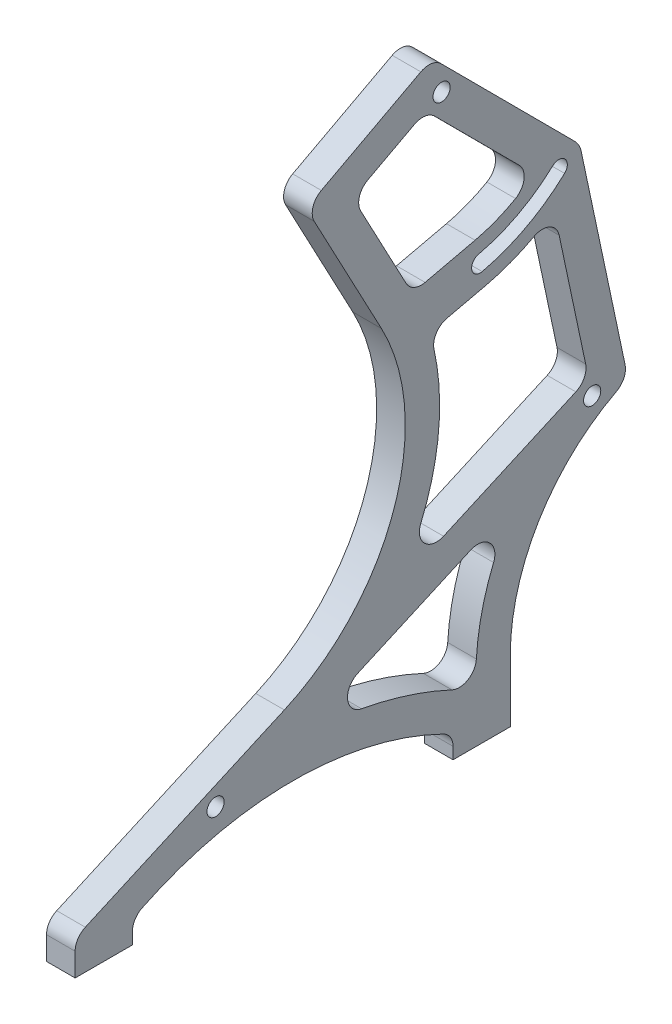
from build123d import *

# Parameters (mm, degrees)
SKETCH1_R                   = 1.5
BOSS_EXTRUDE1_DEPTH         = 5
FILLET1_R                   = 3
TAP_DRILL_FOR_M3_TAP1_D     = 2.5
TAP_DRILL_FOR_M3_TAP1_DEPTH = 7
TAP_DRILL_FOR_M3_TAP1_TIP   = 0.751075774
CUT_EXTRUDE2_REACH          = 146.084
SKETCH7_R                   = 1.5


with BuildPart() as part:
    # Sketch1 → Boss-Extrude1 (new body)
    with BuildSketch(Plane(origin=(0, 0, 0), x_dir=(0, 0, -1), z_dir=(1, 0, 0))):
        with BuildLine():
            Line((0, 0), (0, 6))
            Line((0, 6), (36.541818306, 22.269465723))
            ThreePointArc((36.541818306, 22.269465723), (55.71908903, 43.197784292), (53.491952961, 71.496231166))
            Line((53.491952961, 71.496231166), (40.346749203, 96.218763766))
            Line((40.346749203, 96.218763766), (62.341129166, 107.913383036))
            Line((62.341129166, 107.913383036), (87.292806812, 82.883380245))
            ThreePointArc((87.292806812, 82.883380245), (87.976923892, 81.964881089), (88.3727246, 80.89017244))
            Line((88.3727246, 80.89017244), (95.267840008, 48.415975159))
            Line((95.267840008, 48.415975159), (96.541915319, 42.415412364))
            ThreePointArc((96.541915319, 42.415412364), (81.586078245, 29.641920784), (76, 10.783636674))
            Line((76, 10.783636674), (76, 0))
            Line((76, 0), (66, 0))
            Line((66, 0), (66, 3.884469182))
            ThreePointArc((66, 3.884469182), (38, 10.818472536), (10, 3.884469182))
            Line((10, 3.884469182), (10, 0))
            Line((10, 0), (0, 0))
        make_face()
        with Locations((64, 102)):
            Circle(SKETCH1_R, mode=Mode.SUBTRACT)
        with BuildLine():
            Line((77.130343232, 33.772823644), (39.032120003, 16.810401803))
            ThreePointArc((39.032120003, 16.810401803), (55.025629399, 14.584670036), (70, 8.541951295))
            Line((70, 8.541951295), (70, 10.783636674))
            ThreePointArc((70, 10.783636674), (71.823510959, 22.818424916), (77.130343232, 33.772823644))
        make_face(mode=Mode.SUBTRACT)
        with BuildLine():
            Line((56.201627065, 31.02257653), (89.66384942, 45.920917797))
            Line((89.66384942, 45.920917797), (83.64838467, 74.252189638))
            ThreePointArc((83.64838467, 74.252189638), (77.910999754, 70.976072366), (71.648335848, 68.871417797))
            Line((71.648335848, 68.871417797), (61.936537439, 66.629272466))
            ThreePointArc((61.936537439, 66.629272466), (63.129066114, 48.17201256), (56.201627065, 31.02257653))
        make_face(mode=Mode.SUBTRACT)
        with BuildLine():
            Line((80.108700039, 81.591428686), (61.231449963, 100.527935833))
            Line((61.231449963, 100.527935833), (48.461264136, 93.737907585))
            Line((48.461264136, 93.737907585), (58.884294031, 74.135039414))
            Line((58.884294031, 74.135039414), (69.848727413, 76.666378316))
            ThreePointArc((69.848727413, 76.666378316), (75.251497028, 78.560635362), (80.108700039, 81.591428686))
        make_face(mode=Mode.SUBTRACT)
        with BuildLine():
            ThreePointArc((71.085958212, 71.307342959), (78.788354228, 74.187150825), (85.482948342, 78.962358399))
            ThreePointArc((85.482948342, 78.962358399), (85.556981354, 81.082386492), (83.436953262, 81.156419504))
            ThreePointArc((83.436953262, 81.156419504), (77.379939539, 76.835993604), (70.411105049, 74.230453154))
            ThreePointArc((70.411105049, 74.230453154), (69.286976533, 72.431471475), (71.085958212, 71.307342959))
        make_face(mode=Mode.SUBTRACT)
    extrude(amount=BOSS_EXTRUDE1_DEPTH)

    # Fillet1
    fillet1_edges = [part.edges().sort_by_distance(p)[0] for p in [
        (2.5, 3.884469182, -66),
        (2.5, 3.884469182, -10),
        (2.5, 42.415412364, -96.541915319),
        (2.5, 16.810401803, -39.032120003),
        (2.5, 33.772823644, -77.130343232),
        (2.5, 8.541951295, -70),
        (2.5, 45.920917797, -89.66384942),
        (2.5, 31.02257653, -56.201627065),
        (2.5, 81.591428686, -80.108700039),
        (2.5, 107.913383036, -62.341129166),
        (2.5, 100.527935833, -61.231449963),
        (2.5, 93.737907585, -48.461264136),
        (2.5, 74.135039414, -58.884294031),
        (2.5, 6, 0),
        (2.5, 66.629272466, -61.936537439),
        (2.5, 74.252189638, -83.64838467),
        (2.5, 96.218763766, -40.346749203),
    ]]
    fillet(fillet1_edges, radius=FILLET1_R)

    # Tap Drill for M3 Tap1
    with Locations(Plane(origin=(0, 0, 0), x_dir=(-1, 0, 0), z_dir=(0, -1, 0))):
        with Locations((-2.5, 5.5), (-2.5, 70.5)):
            Hole(TAP_DRILL_FOR_M3_TAP1_D / 2, depth=TAP_DRILL_FOR_M3_TAP1_DEPTH)
            with Locations((0, 0, -(TAP_DRILL_FOR_M3_TAP1_DEPTH + TAP_DRILL_FOR_M3_TAP1_TIP / 2))):  # 118° drill point
                Cone(0, TAP_DRILL_FOR_M3_TAP1_D / 2, TAP_DRILL_FOR_M3_TAP1_TIP, mode=Mode.SUBTRACT)

    # Sketch7 → Cut-Extrude2 (cut, up to next)
    with BuildSketch(Plane(origin=(5, 0, 0), x_dir=(0, 0, -1), z_dir=(1, 0, 0)), mode=Mode.PRIVATE) as cut_extrude2_sk1:
        with Locations((24.525614125, 13.635598098)):
            Circle(SKETCH7_R)
    cut_extrude2_tool1 = extrude(cut_extrude2_sk1.sketch, amount=-CUT_EXTRUDE2_REACH, mode=Mode.PRIVATE) & part.part
    # Sketch7 → Cut-Extrude2 (cut, up to next)
    with BuildSketch(Plane(origin=(5, 0, 0), x_dir=(0, 0, -1), z_dir=(1, 0, 0)), mode=Mode.PRIVATE) as cut_extrude2_sk2:
        with Locations((90.300887075, 42.920636399)):
            Circle(SKETCH7_R)
    cut_extrude2_tool2 = extrude(cut_extrude2_sk2.sketch, amount=-CUT_EXTRUDE2_REACH, mode=Mode.PRIVATE) & part.part
    add(cut_extrude2_tool1.solids().sort_by_distance((5, 13.635598, -24.525614))[0], mode=Mode.SUBTRACT)
    add(cut_extrude2_tool2.solids().sort_by_distance((5, 42.920636, -90.300887))[0], mode=Mode.SUBTRACT)


solid = part.part
